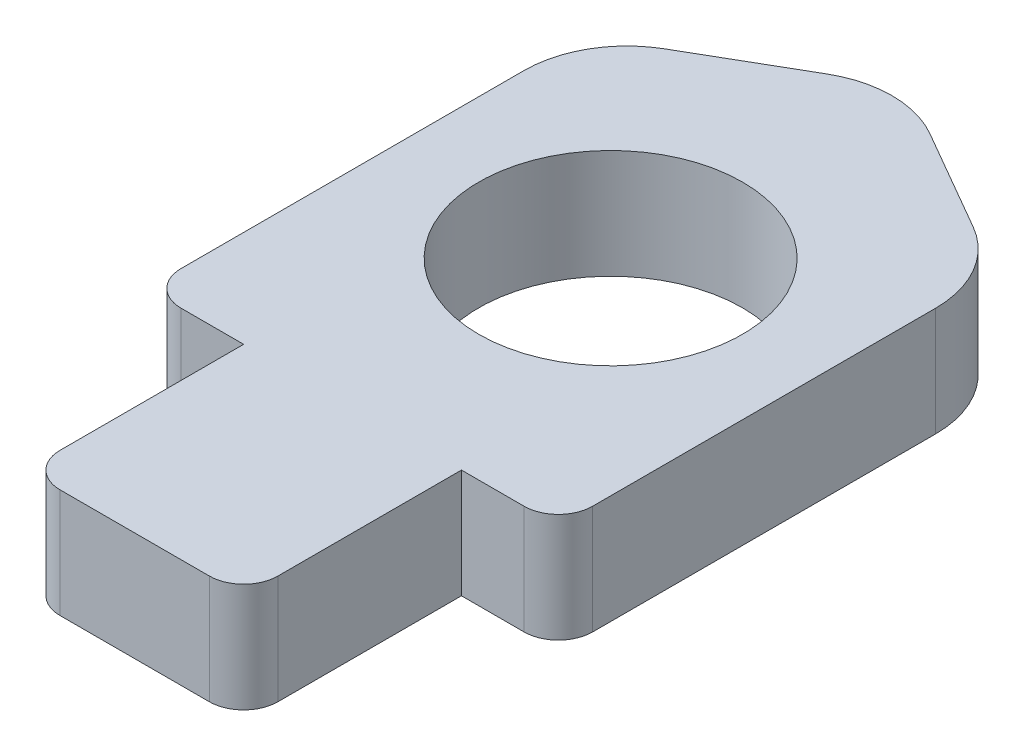
from build123d import *

# Parameters (mm, degrees)
SKETCH2_R           = 3.845
BOSS_EXTRUDE1_DEPTH = 3.175
FILLET1_R           = 1


with BuildPart() as part:
    # Sketch2 → Boss-Extrude1 (new body)
    with BuildSketch(Plane(origin=(0, 0, 0), x_dir=(1, 0, 0), z_dir=(0, 1, 0))):
        with BuildLine():
            ThreePointArc((-5.449489743, 5.205), (-5.859061842, 4.381665532), (-6, 3.472949192))
            Line((-6, 3.472949192), (-6, -7.5237274))
            Line((-6, -7.5237274), (-3.175, -7.5237274))
            Line((-3.175, -7.5237274), (-3.175, -13.8737274))
            Line((-3.175, -13.8737274), (3.175, -13.8737274))
            Line((3.175, -13.8737274), (3.175, -7.5237274))
            Line((3.175, -7.5237274), (6, -7.5237274))
            Line((6, -7.5237274), (6, 3.472949192))
            ThreePointArc((6, 3.472949192), (5.859061842, 4.381665532), (5.449489743, 5.205))
            ThreePointArc((5.449489743, 5.205), (5.021662016, 5.689451548), (4.5, 6.071025404))
            Line((4.5, 6.071025404), (1.5, 7.803076211))
            ThreePointArc((1.5, 7.803076211), (0, 8.205), (-1.5, 7.803076211))
            Line((-1.5, 7.803076211), (-4.5, 6.071025404))
            ThreePointArc((-4.5, 6.071025404), (-5.021662016, 5.689451548), (-5.449489743, 5.205))
        make_face()
        Circle(SKETCH2_R, mode=Mode.SUBTRACT)
    extrude(amount=BOSS_EXTRUDE1_DEPTH)

    # Fillet1
    fillet1_edges = [part.edges().sort_by_distance(p)[0] for p in [
        (6, 1.5875, 7.5237274),
        (-6, 1.5875, 7.5237274),
        (-3.175, 1.5875, 13.8737274),
        (3.175, 1.5875, 13.8737274),
    ]]
    fillet(fillet1_edges, radius=FILLET1_R)


solid = part.part
